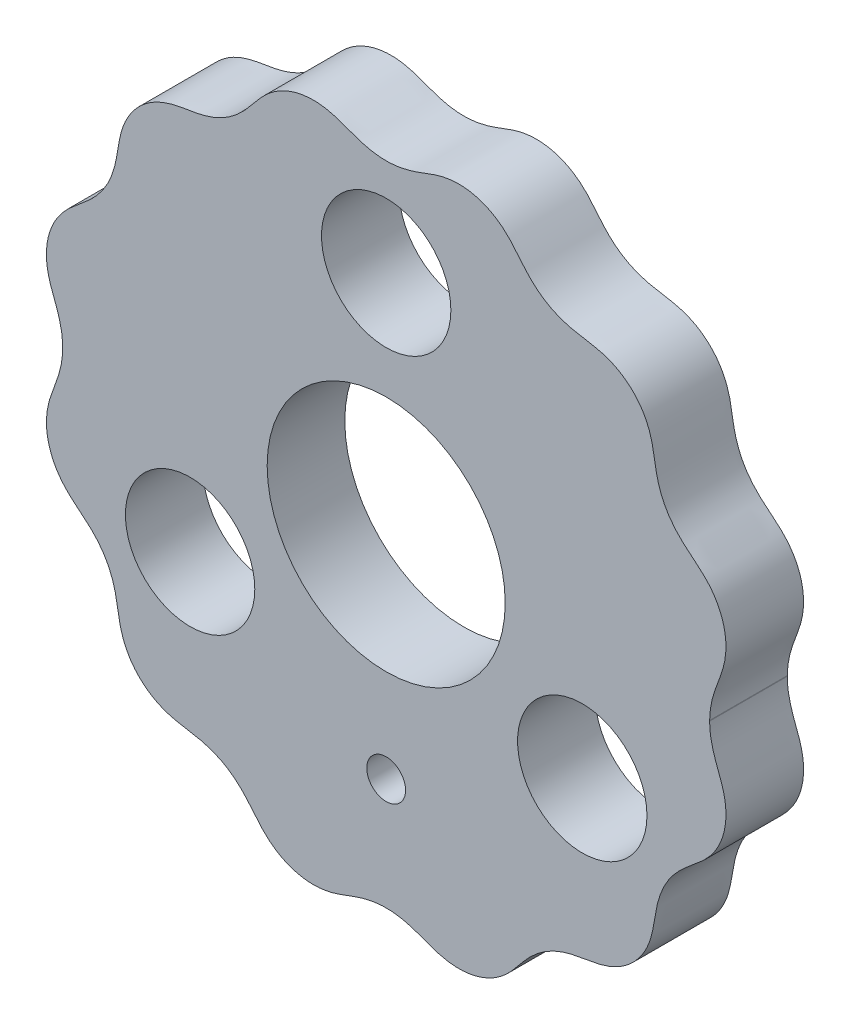
from build123d import *

# Parameters (mm, degrees)
BOSS_EXTRUDE2_OUTLINE_R   = 5
BOSS_EXTRUDE2_OUTLINE_R_2 = 9.2
BOSS_EXTRUDE2_DEPTH       = 6
CUT_EXTRUDE1_DEPTH        = 38.619682985
CUT_EXTRUDE1_DEPTH_BACK   = 38.619682985
SKETCH4_R                 = 1.5


# Read off the part's stored shape, not the designer's step: Boss-Extrude2
with BuildPart() as part:
    # Boss-Extrude2 outline → Boss-Extrude2 (new body)
    with BuildSketch(Plane.XY):
        with BuildLine():
            Line((25, 0), (25.000203175, 0.049701947))
            add(Edge.make_bspline(
                [(25.000203175, 0.049701947), (25.000430803, 0.077544036), (25.00135895, 0.133217809), (25.005267885, 0.264321243), (25.016960864, 0.482504301), (25.038505918, 0.70465122), (25.074119122, 0.965148365), (25.120257899, 1.224415288), (25.176361339, 1.480873774), (25.241721849, 1.735435761), (25.333860765, 2.050706314), (25.458833672, 2.424502992), (25.619629464, 2.855327013), (25.80790495, 3.345695262), (25.967232391, 3.802316147), (26.088108997, 4.226630913), (26.191439435, 4.704296235), (26.28479299, 5.412288327), (26.262511444, 6.413848041), (25.940942688, 7.662077141), (25.246796647, 8.857951736), (24.343684699, 9.769551905), (23.415648604, 10.48411951), (22.610070929, 11.192473379), (21.915401419, 12.012841988), (21.374668771, 12.943487437), (21.00656033, 13.953487), (20.791787115, 15.004742729), (20.637904711, 16.165690953), (20.307180817, 17.405403853), (19.622089623, 18.615234931), (18.697120313, 19.53023506), (17.751576334, 20.105941467), (16.818953838, 20.466007301), (15.93734026, 20.668117182), (14.959093015, 20.79921578), (13.905080963, 21.019330701), (12.898969216, 21.396054985), (11.977973527, 21.941022037), (11.170105737, 22.633979321), (10.474070774, 23.429151565), (9.770417048, 24.341030317), (8.877880267, 25.227310889), (7.702048601, 25.922603812), (6.29085556, 26.300692327), (4.924909383, 26.286396603), (3.708827205, 25.965063812), (2.643510183, 25.527172752), (1.643127458, 25.186582226), (0.597006536, 24.990441303), (-0.473083435, 24.979033961), (-1.532755887, 25.155882506), (-2.55560208, 25.492296977), (-3.468339345, 25.867884001), (-4.332905845, 26.133623194), (-5.32062142, 26.288060185), (-6.427337904, 26.262197332), (-7.685868846, 25.932204762), (-8.884052218, 25.226941722), (-9.790282182, 24.318640694), (-10.504008287, 23.390162439), (-11.215678135, 22.58716662), (-12.039474616, 21.896555136), (-12.973147938, 21.361026229), (-13.984887122, 20.997904882), (-15.036829757, 20.787344769), (-16.197622229, 20.632400397), (-17.435839429, 20.294614033), (-18.483671803, 19.692277913), (-19.300149626, 18.928757994), (-19.95690194, 18.028441349), (-20.395622874, 17.11611043), (-20.653045268, 16.060286336), (-20.806135146, 14.914602211), (-21.026718925, 13.886522177), (-21.397747575, 12.897748952), (-21.936896568, 11.984292454), (-22.62699323, 11.1763696), (-23.427022399, 10.47557852), (-24.34504384, 9.767557339), (-25.237701394, 8.866637346), (-25.933564455, 7.678441647), (-26.261093111, 6.43001327), (-26.288515222, 5.328583568), (-26.135455064, 4.34059116), (-25.870736407, 3.4757204), (-25.495205931, 2.562927815), (-25.157831343, 1.540454587), (-24.979676648, 0.481005828), (-24.98964456, -0.589100982), (-25.184526072, -1.63546138), (-25.524214021, -2.636206013), (-25.96232166, -3.701401982), (-26.285367064, -4.916976266), (-26.301679816, -6.282910402), (-25.925709908, -7.694669196), (-25.232158972, -8.871517572), (-24.347111984, -9.765350187), (-23.435367487, -10.469229858), (-22.639598338, -11.164500934), (-21.945671579, -11.971536034), (-21.399469544, -12.891789727), (-21.021499046, -13.897450049), (-20.800368009, -14.951283195), (-20.669325741, -15.929542243), (-20.468260184, -16.811352879), (-20.109505434, -17.744490957), (-19.535225069, -18.69087907), (-18.621589199, -19.617234196), (-17.412795128, -20.30409628), (-16.17349347, -20.636604415), (-15.012542859, -20.790681073), (-13.961150534, -21.004447957), (-12.950687048, -21.371323607), (-12.019349647, -21.910802096), (-11.198070814, -22.604475083), (-10.489042176, -23.409443312), (-9.774472842, -24.337578456), (-8.864535557, -25.241992085), (-7.819413481, -25.850368791), (-6.751118437, -26.176673588), (-5.827195666, -26.277840049), (-5.084141891, -26.255225085), (-4.274357012, -26.11935553), (-3.419229104, -25.84785235), (-2.520449471, -25.479461333), (-1.520966388, -25.154635937), (-0.478930933, -24.980713481), (0.581426656, -24.989102643), (1.62667227, -25.181750578), (2.633674004, -25.522967435), (3.706115601, -25.964583322), (4.931582798, -26.288472232), (6.309337856, -26.299864083), (7.731407454, -25.911659846), (8.912502074, -25.202295013), (9.803864636, -24.301158332), (10.510510486, -23.382376891), (11.217263285, -22.586282659), (12.23711891, -21.731124361), (13.439402762, -21.1258531), (14.739949908, -20.826544524), (16.151486918, -20.639994045), (17.377311503, -20.316253266), (18.57817853, -19.648167397), (19.620081418, -18.614367157), (20.295790024, -17.423577203), (20.629229677, -16.210615672), (20.783152218, -15.069054613), (20.986474338, -14.032216693), (21.337087227, -13.027141562), (21.859772382, -12.093532725), (22.540451444, -11.262027255), (23.242034799, -10.633504856), (23.872924134, -10.132867754), (24.559448754, -9.548775191), (25.250933039, -8.824024045), (25.900590468, -7.758927573), (26.248865742, -6.509268079), (26.29301302, -5.400577617), (26.169082038, -4.536352918), (26.007461604, -3.919608843), (25.837320412, -3.428807717), (25.69530689, -3.052450734), (25.552791346, -2.676356937), (25.437671669, -2.361532194), (25.33146082, -2.043525868), (25.23785416, -1.72161835), (25.171720804, -1.461619521), (25.122348392, -1.232409452), (25.086561311, -1.034185241), (25.0612711, -0.868216065), (25.043819456, -0.735775062), (25.029199756, -0.604110594), (25.017454216, -0.471095426), (25.008616202, -0.331732724), (25.002710517, -0.186096381), (25.000492821, -0.085240091), (25, -0.028419379), (25, 0)],
                knots=[0.076056741, 0.076056741, 0.076056741, 0.076056741, 0.076056741, 0.076703243, 0.077349745, 0.078642749, 0.079935752, 0.081228756, 0.08252176, 0.083814764, 0.085107767, 0.086400771, 0.088986778, 0.091572786, 0.094158793, 0.096744801, 0.098500792, 0.100256782, 0.103768764, 0.110792728, 0.118067134, 0.125341539, 0.130608789, 0.135876039, 0.141143288, 0.146410538, 0.151677938, 0.156945338, 0.162212739, 0.167480139, 0.174754449, 0.18202876, 0.18920239, 0.192789205, 0.19637602, 0.201662086, 0.206948152, 0.212234217, 0.217520283, 0.222711529, 0.227902775, 0.233094021, 0.238285267, 0.245396057, 0.252506847, 0.259617637, 0.266728427, 0.271919673, 0.27711092, 0.282302167, 0.287493413, 0.292779479, 0.298065544, 0.303351609, 0.308637675, 0.31222449, 0.315811305, 0.322984935, 0.330259245, 0.337533554, 0.342800956, 0.348068357, 0.353335759, 0.35860316, 0.363870408, 0.369137657, 0.374404905, 0.379672154, 0.38694656, 0.394220967, 0.397870664, 0.40152036, 0.408819754, 0.413980022, 0.419140289, 0.424300557, 0.429460825, 0.434683501, 0.439906177, 0.445128853, 0.450351529, 0.45752531, 0.464699092, 0.471872729, 0.475459548, 0.479046367, 0.484332412, 0.489618457, 0.494904502, 0.500190547, 0.505381816, 0.510573085, 0.515764354, 0.520955624, 0.528066401, 0.535177178, 0.54228798, 0.549398783, 0.55459001, 0.559781237, 0.564972465, 0.570163692, 0.575449774, 0.580735857, 0.58602194, 0.591308022, 0.594894834, 0.598481645, 0.605655268, 0.612929603, 0.620203938, 0.625471301, 0.630738664, 0.636006027, 0.641273391, 0.646540677, 0.651807963, 0.657075249, 0.662342536, 0.669616919, 0.676891303, 0.680541003, 0.684190704, 0.687840405, 0.691490106, 0.696650345, 0.701810583, 0.706970822, 0.712131061, 0.717353769, 0.722576478, 0.727799187, 0.733021896, 0.740195659, 0.747369423, 0.754543079, 0.761716735, 0.766939688, 0.772162642, 0.777385595, 0.782608548, 0.793054367, 0.798277276, 0.803500185, 0.810673859, 0.817847534, 0.824958349, 0.832069164, 0.837260376, 0.842451588, 0.8476428, 0.852834012, 0.858120108, 0.863406204, 0.8686923, 0.871335348, 0.873978395, 0.881152011, 0.888325626, 0.895576471, 0.899201893, 0.902827316, 0.905466854, 0.908106393, 0.909426162, 0.910745932, 0.91338547, 0.91470524, 0.916025009, 0.917344778, 0.918664548, 0.919324432, 0.919984317, 0.920644202, 0.921304086, 0.921963971, 0.922623856, 0.92328374, 0.923943625, 0.923943625, 0.923943625, 0.923943625, 0.923943625], degree=4))
        make_face()
        with Locations((-15.155444566, -8.75)):
            Circle(BOSS_EXTRUDE2_OUTLINE_R, mode=Mode.SUBTRACT)
        Circle(BOSS_EXTRUDE2_OUTLINE_R_2, mode=Mode.SUBTRACT)
        with Locations((15.155444566, -8.75)):
            Circle(BOSS_EXTRUDE2_OUTLINE_R, mode=Mode.SUBTRACT)
        with Locations((0, 17.5)):
            Circle(BOSS_EXTRUDE2_OUTLINE_R, mode=Mode.SUBTRACT)
    extrude(amount=BOSS_EXTRUDE2_DEPTH)

    # Sketch4 → Cut-Extrude1 (cut, two sides: drawn at the far end of the back side and taken through both)
    with BuildSketch(Plane.XY.offset(6).offset(-CUT_EXTRUDE1_DEPTH_BACK)):
        with Locations((0, -16.383258913)):
            Circle(SKETCH4_R)
    extrude(amount=CUT_EXTRUDE1_DEPTH + CUT_EXTRUDE1_DEPTH_BACK, mode=Mode.SUBTRACT)


solid = part.part
